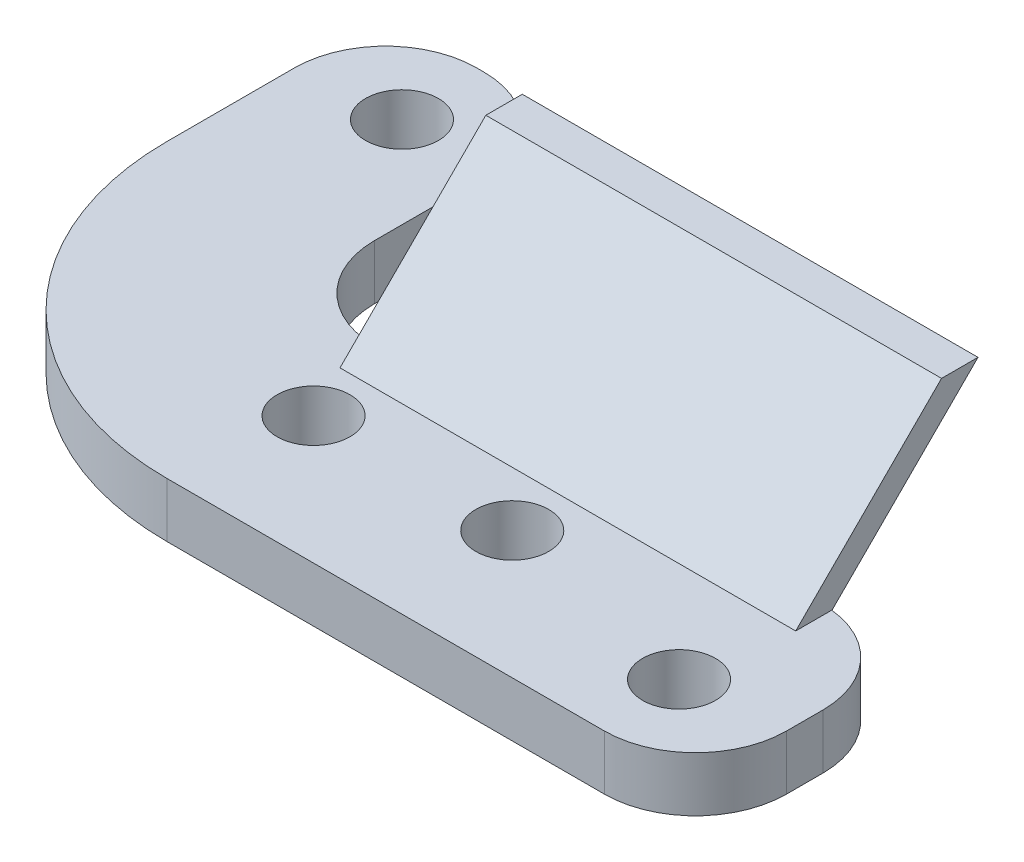
from build123d import *

# Parameters (mm, degrees)
SKETCH1_W                = 45
SKETCH1_H                = 28
BOSS_EXTRUDE1_DEPTH      = 3
F_4_0_4_DIAMETER_HOLE1_D = 4
F_4_0_4_DIAMETER_HOLE2_D = 4
SKETCH10_W               = 34.6
SKETCH10_H               = 16
CUT_EXTRUDE2_DEPTH       = 3
FILLET2_R                = 5
FILLET3_R                = 16
BOSS_EXTRUDE2_START      = -5
BOSS_EXTRUDE2_DEPTH      = 25
SKETCH12_W               = 17.420537897
SKETCH12_H               = 1.5
CUT_EXTRUDE3_DEPTH       = 3
FILLET4_R                = 2
CHAMFER1_SIZE            = 2


with BuildPart() as part:
    # Sketch1 → Boss-Extrude1 (new body)
    with BuildSketch(Plane(origin=(0, 0, 0), x_dir=(1, 0, 0), z_dir=(0, 1, 0))):
        Rectangle(SKETCH1_W, SKETCH1_H)
    extrude(amount=BOSS_EXTRUDE1_DEPTH)

    # Ø4.0 (4) Diameter Hole1 (through all)
    with Locations(Plane(origin=(0, 3, 0), x_dir=(1, 0, 0), z_dir=(0, 1, 0))):
        with Locations((-17.1, 9.5), (17.1, -9.5)):
            Hole(F_4_0_4_DIAMETER_HOLE1_D / 2)

    # Ø4.0 (4) Diameter Hole2 (through all)
    with Locations(Plane(origin=(0, 3, 0), x_dir=(1, 0, 0), z_dir=(0, 1, 0))):
        with Locations((-5.45, -7), (5.45, -7)):
            Hole(F_4_0_4_DIAMETER_HOLE2_D / 2)

    # Sketch10 → Cut-Extrude2 (cut)
    with BuildSketch(Plane(origin=(0, 3, 0), x_dir=(1, 0, 0), z_dir=(0, 1, 0))):
        with Locations((5.2, 6)):
            Rectangle(SKETCH10_W, SKETCH10_H)
    extrude(amount=-CUT_EXTRUDE2_DEPTH, mode=Mode.SUBTRACT)

    # Fillet2
    fillet2_edges = [part.edges().sort_by_distance(p)[0] for p in [
        (-12.1, 1.5, -14),
        (22.5, 1.5, 2),
        (-12.1, 1.5, 2),
        (-22.5, 1.5, -14),
        (22.5, 1.5, 14),
    ]]
    fillet(fillet2_edges, radius=FILLET2_R)

    # Fillet3
    fillet3_edges = [part.edges().sort_by_distance(p)[0] for p in [
        (-22.5, 1.5, 14),
    ]]
    fillet(fillet3_edges, radius=FILLET3_R)

    # Sketch11 → Boss-Extrude2 (add)
    with BuildSketch(Plane(origin=(23, 0, 0), x_dir=(0, 0, -1), z_dir=(1, 0, 0)).offset(BOSS_EXTRUDE2_START)):
        Polygon((-4, 3), (4, 11), (6, 11), (-2, 3), align=None)
    extrude(amount=-BOSS_EXTRUDE2_DEPTH)

    # Sketch12 → Cut-Extrude3 (cut)
    with BuildSketch(Plane.XZ):
        with Locations((5.806845965, 2.75)):
            Rectangle(SKETCH12_W, SKETCH12_H)
    extrude(amount=-CUT_EXTRUDE3_DEPTH, mode=Mode.SUBTRACT)

    # Fillet4
    # the kernel refuses this fillet: 2 mm, written as the material it takes off along each edge
    with BuildSketch(Plane(origin=(-2.903422983, -4.841229183, 2), x_dir=(0, 0, 1), z_dir=(0, 1, 0))) as fillet4_piece_1:
        with BuildLine():
            CenterArc((2, -1.936491673), FILLET4_R, 104.477512186, 75.522487814)
            Line((0, -1.936491673), (0, 0))
            Line((0, 0), (1.5, 0))
        make_face()
    extrude(amount=7.841229183, mode=Mode.SUBTRACT)
    with BuildSketch(Plane(origin=(14.517114914, -4.841229183, 2), x_dir=(1, 0, 0), z_dir=(0, 1, 0))) as fillet4_piece_2:
        with BuildLine():
            CenterArc((1.936491673, -2), FILLET4_R, 90, 75.522487814)
            Line((0, -1.5), (0, 0))
            Line((0, 0), (1.936491673, 0))
        make_face()
    extrude(amount=7.841229183, mode=Mode.SUBTRACT)

    # Chamfer1
    # the kernel refuses this chamfer: 2 mm, written as the material it adds along each edge
    with BuildSketch(Plane(origin=(-4.839914656, 3, 4), x_dir=(-0.680858233566239, 0, 0.732415227712437), z_dir=(-0.732415227712437, 0, -0.680858233566239))) as chamfer1_piece_1_section:
        Polygon((2, -CHAMFER1_SIZE), (2 + CHAMFER1_SIZE, 0), (2, 0), align=None)
    chamfer1_piece_1 = revolve(axis=Axis((-4.839914656, 3, 4), (0, 1, 0)), revolution_arc=222.910744897, mode=Mode.PRIVATE)
    chamfer1_piece_1 = split(chamfer1_piece_1, bisect_by=Plane(origin=(-2.32351346, 2.593002324, 2), z_dir=(0, 0, 1)), keep=Keep.TOP, mode=Mode.PRIVATE)
    chamfer1_piece_1 = split(chamfer1_piece_1, bisect_by=Plane(origin=(-2.32351346, 2.593002324, 3.5), z_dir=(0, 0, -1)), keep=Keep.TOP, mode=Mode.PRIVATE)
    add(chamfer1_piece_1)
    with BuildSketch(Plane(origin=(16.453606588, 3, 4), x_dir=(0, 0, -1), z_dir=(1, 0, 0))) as chamfer1_piece_2_section:
        Polygon((2, -CHAMFER1_SIZE), (2 + CHAMFER1_SIZE, 0), (2, 0), align=None)
    chamfer1_piece_2 = revolve(axis=Axis((16.453606588, 3, 4), (0, 1, 0)), revolution_arc=222.910744897, mode=Mode.PRIVATE)
    chamfer1_piece_2 = split(chamfer1_piece_2, bisect_by=Plane(origin=(14.636969069, 2.019912547, 2), z_dir=(0, 0, 1)), keep=Keep.TOP, mode=Mode.PRIVATE)
    chamfer1_piece_2 = split(chamfer1_piece_2, bisect_by=Plane(origin=(14.636969069, 3.296842404, 3.703157596), z_dir=(0, -0.7071067811865511, -0.7071067811865439)), keep=Keep.TOP, mode=Mode.PRIVATE)
    add(chamfer1_piece_2)


solid = part.part
